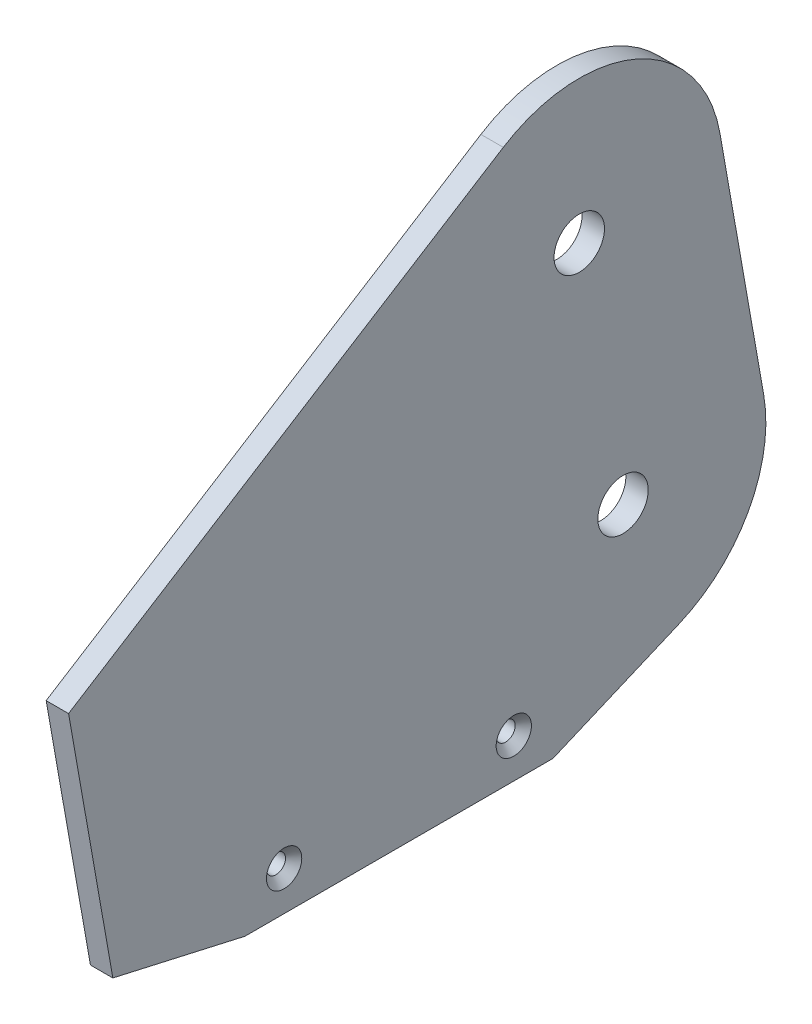
from build123d import *

# Parameters (mm, degrees)
BOSS_EXTRUDE1_DEPTH                             = 4
HOLE1_D                                         = 9
HOLE1_DEPTH                                     = 100
CSK_FOR_M3_FLAT_HEAD_MACHINE_SCREW1_D           = 3.4
CSK_FOR_M3_FLAT_HEAD_MACHINE_SCREW1_CSINK_D     = 6.3
CSK_FOR_M3_FLAT_HEAD_MACHINE_SCREW1_CSINK_ANGLE = 90


with BuildPart() as part:
    # Sketch2 → Boss-Extrude1 (new body)
    with BuildSketch(Plane(origin=(25, 0, 0), x_dir=(0, 0, -1), z_dir=(1, 0, 0))):
        with BuildLine():
            Line((-27.5, 37), (-51.076666655, 42.342361278))
            Line((-51.076666655, 42.342361278), (-58.982401164, 87.17800967))
            Line((-58.982401164, 87.17800967), (18.625078501, 135.911625323))
            ThreePointArc((18.625078501, 135.911625323), (42.53183975, 137.623217481), (57.298429707, 118.744377416))
            Line((57.298429707, 118.744377416), (65.112597702, 74.428028531))
            ThreePointArc((65.112597702, 74.428028531), (62.407971082, 57.829016803), (49.95644752, 46.524072909))
            Line((49.95644752, 46.524072909), (27.5, 37))
            Line((27.5, 37), (-27.5, 37))
        make_face()
    extrude(amount=BOSS_EXTRUDE1_DEPTH)

    # Hole1
    with Locations(Plane.ZY.offset(-25)):
        with Locations((-32.185832005, 114.316348886), (-40, 70)):
            Hole(HOLE1_D / 2, depth=HOLE1_DEPTH)

    # CSK for M3 Flat Head Machine Screw1 (through all)
    with Locations(Plane(origin=(29, 0, 0), x_dir=(0, 0, -1), z_dir=(1, 0, 0))):
        with Locations((20.5, 44), (-20.5, 44)):
            CounterSinkHole(CSK_FOR_M3_FLAT_HEAD_MACHINE_SCREW1_D / 2, CSK_FOR_M3_FLAT_HEAD_MACHINE_SCREW1_CSINK_D / 2, counter_sink_angle=CSK_FOR_M3_FLAT_HEAD_MACHINE_SCREW1_CSINK_ANGLE)


solid = part.part
